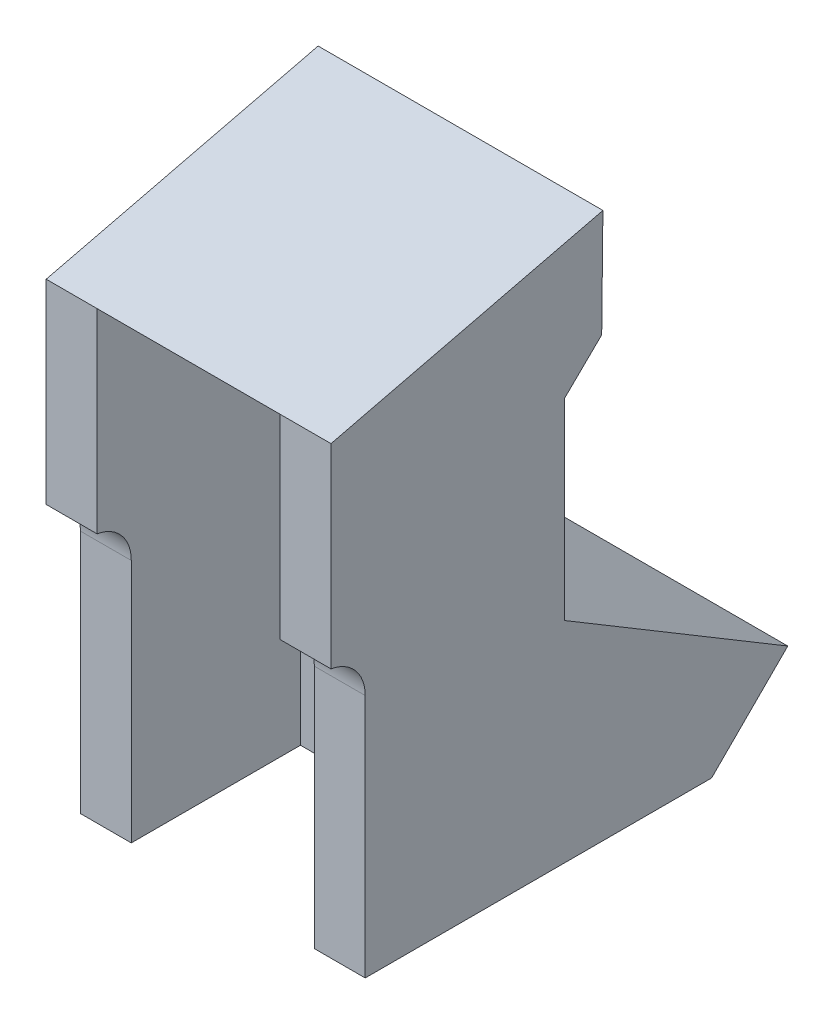
from build123d import *
from OCP.BRepFilletAPI import BRepFilletAPI_MakeChamfer

# Parameters (mm, degrees)
BOSS_EXTRUDE5_DEPTH = 14
SKETCH6_W           = 9
SKETCH6_H           = 23.591652045
CUT_EXTRUDE1_DEPTH  = 10
FILLET1_R           = 2
CHAMFER1_SIZE       = 10
CHAMFER1_SIZE2      = 7.296849953
CHAMFER1_SIZE2_2    = 7.289947028


with BuildPart() as part:
    # Sketch4 → Boss-Extrude5 (new body)
    with BuildSketch(Plane(origin=(0, 0, 0), x_dir=(0, 0, -1), z_dir=(1, 0, 0))):
        Polygon((-4.421768707, 9.149659864), (14.353741497, 13.707482993), (5.37414966, 4.927966044), (5.37414966, -4.527816269), (22.605249741, -14.850340136), (-4.421768707, -14.850340136), (-4.421768707, -0.850340136), (-6.10391849, -0.850340136), (-6.10391849, 8.741311909), align=None)
    extrude(amount=BOSS_EXTRUDE5_DEPTH)

    # Sketch6 → Cut-Extrude1 (cut)
    with BuildSketch(Plane.XY.offset(6.10391849)):
        with Locations((7, -3.054514114)):
            Rectangle(SKETCH6_W, SKETCH6_H)
    extrude(amount=-CUT_EXTRUDE1_DEPTH, mode=Mode.SUBTRACT)

    # Fillet1
    # the kernel refuses this fillet: 2 mm, written as the material it adds along each edge
    with BuildSketch(Plane(origin=(0, -0.850340136, 4.421768707), x_dir=(0, -1, 0), z_dir=(1, 0, 0))) as fillet1_piece_1:
        with BuildLine():
            CenterArc((1.974581282, -2), FILLET1_R, 90, 80.855488808)
            Line((0, -1.682149783), (-0.039491626, -1.675792779))
            ThreePointArc((-0.039491626, -1.675792779), (-0.04, -0.841074891), (-0.04, 0))
            Line((-0.04, 0), (0, 0.04))
            Line((0, 0.04), (1.974581282, 0.04))
            Line((1.974581282, 0.04), (1.974581282, 0))
        make_face()
    extrude(amount=2.5)
    with BuildSketch(Plane(origin=(11.5, -0.850340136, 4.421768707), x_dir=(0, 0, 1), z_dir=(1, 0, 0))) as fillet1_piece_2:
        with BuildLine():
            CenterArc((2, 1.974581282), FILLET1_R, 180, 80.855488808)
            Line((0, 1.974581282), (-0.04, 1.974581282))
            Line((-0.04, 1.974581282), (-0.04, 0))
            Line((-0.04, 0), (0, -0.04))
            ThreePointArc((0, -0.04), (0.841074891, -0.04), (1.675792779, -0.039491626))
            Line((1.675792779, -0.039491626), (1.682149783, 0))
        make_face()
    extrude(amount=2.5)

    # Chamfer1: one chamfer whose edges measure the first distance from different faces: ONE call of the kernel's chamfer builder (chamfer() names one face for all edges)
    chamfer1_edges_1 = [part.edges().sort_by_distance(p)[0] for p in [
        (7, 13.707482993, -14.353741497),
    ]]
    chamfer1_side_1 = [part.faces().sort_by_distance(p)[0] for p in [
        (7, 9.317724519, -9.863945578),
    ]]
    chamfer1_edges_2 = [part.edges().sort_by_distance(p)[0] for p in [
        (7, -14.850340136, -22.605249741),
    ]]
    chamfer1_side_2 = [part.faces().sort_by_distance(p)[0] for p in [
        (7, -14.850340136, -11.398988107),
    ]]
    chamfer1 = BRepFilletAPI_MakeChamfer(part.part.solid().wrapped)
    for e in chamfer1_edges_1:
        chamfer1.Add(CHAMFER1_SIZE, CHAMFER1_SIZE2, e.wrapped, chamfer1_side_1[0].wrapped)  # the first distance lies on this face
    for e in chamfer1_edges_2:
        chamfer1.Add(CHAMFER1_SIZE, CHAMFER1_SIZE2_2, e.wrapped, chamfer1_side_2[0].wrapped)  # the first distance lies on this face
    add(Compound.cast(chamfer1.Shape()), mode=Mode.REPLACE)


solid = part.part
